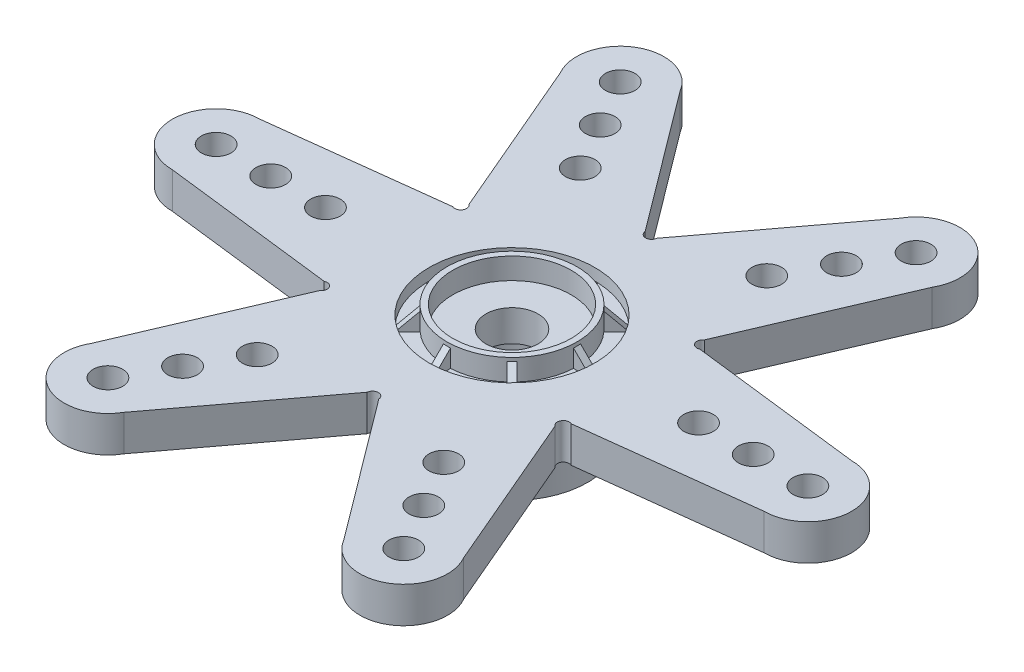
from build123d import *

# Parameters (mm, degrees)
EXTRUDE4_DEPTH          = 1.9304
SKETCH2_R               = 0.6604
CUT_EXTRUDE1_DEPTH      = 19.722050478
CIRPATTERN4_COUNT       = 6
CUT_EXTRUDE2_DEPTH      = 12.7
CUT_EXTRUDE2_DEPTH_BACK = 12.7
SKETCH3_R               = 1.397
SKETCH4_R               = 4.445
CUT_EXTRUDE3_DEPTH      = 0.635
SKETCH5_R               = 3.4925
SKETCH5_R_2             = 3.175
EXTRUDE5_DEPTH          = 1.143
RIB10_REACH             = 26.438
SKETCH8_WALL_W          = 52.220152264
SKETCH8_WALL_H          = 0.381
CIRPATTERN5_COUNT       = 8
SKETCH9_R               = 0.79375
CUT_EXTRUDE4_DEPTH      = 25.392925761
CIRPATTERN6_COUNT       = 6
SKETCH10_R              = 5.08
EXTRUDE6_DEPTH          = 0.762
FILLET2_R               = 0.508
SKETCH11_R              = 4.064
EXTRUDE7_DEPTH          = 3.048
FILLET3_R               = 0.889
SKETCH12_R              = 2.8575
CUT_EXTRUDE5_DEPTH      = 3.429
SKETCH14_R              = 1.397
CUT_EXTRUDE6_DEPTH      = 25.557003564
SKETCH15_R              = 0.3175
CUT_EXTRUDE7_DEPTH      = 25.984806887
CIRPATTERN7_COUNT       = 6


with BuildPart() as part:
    # Sketch1 → Extrude4 (new body)
    with BuildSketch(Plane(origin=(0, 0, 0), x_dir=(1, 0, 0), z_dir=(0, 1, 0))):
        with BuildLine():
            Line((5.775220615, -3.829827046), (0, 0))
            Line((0, 0), (5.775220615, 3.829827046))
            Line((5.775220615, 3.829827046), (6.35029977, 3.829827046))
            Line((6.35029977, 3.829827046), (6.35029977, 3.494998084))
            Line((6.35029977, 3.494998084), (15.87469147, 2.35207108))
            ThreePointArc((15.87469147, 2.35207108), (18.22419147, 0.00257108), (15.87469147, -2.34692892))
            Line((15.87469147, -2.34692892), (6.34969147, -3.48992892))
            Line((6.34969147, -3.48992892), (6.34969147, -3.829827046))
            Line((6.34969147, -3.829827046), (5.775220615, -3.829827046))
        make_face()
    extrude4 = extrude(amount=EXTRUDE4_DEPTH)

    # Sketch2 → Cut-Extrude1 (cut, through all)
    with BuildSketch(Plane(origin=(0, 1.9304, 0), x_dir=(-1, 0, 0), z_dir=(0, 1, 0))):
        with Locations((-6.342552501, -4.149920748)):
            Circle(SKETCH2_R)
        with Locations((-6.342552501, 4.149920748)):
            Circle(SKETCH2_R)
    extrude(amount=-CUT_EXTRUDE1_DEPTH, mode=Mode.SUBTRACT)

    # CirPattern4: Extrude4 ×6 about axis
    cirpattern4_axis = Axis((0, 0, 0), (0, 1, 0))
    for i in range(1, CIRPATTERN4_COUNT):
        add(extrude4.rotate(cirpattern4_axis, i * 360 / CIRPATTERN4_COUNT))

    # Sketch3 → Cut-Extrude2 (cut, two sides: drawn at the far end of the back side and taken through both)
    with BuildSketch(Plane(origin=(0, 1.9304, 0), x_dir=(-1, 0, 0), z_dir=(0, 1, 0)).offset(-CUT_EXTRUDE2_DEPTH_BACK)):
        Circle(SKETCH3_R)
    extrude(amount=CUT_EXTRUDE2_DEPTH + CUT_EXTRUDE2_DEPTH_BACK, mode=Mode.SUBTRACT)

    # Sketch4 → Cut-Extrude3 (cut)
    with BuildSketch(Plane(origin=(0, 1.9304, 0), x_dir=(-1, 0, 0), z_dir=(0, 1, 0))):
        Circle(SKETCH4_R)
    extrude(amount=-CUT_EXTRUDE3_DEPTH, mode=Mode.SUBTRACT)

    # Sketch5 → Extrude5 (add)
    with BuildSketch(Plane(origin=(0, 1.2954, 0), x_dir=(-1, 0, 0), z_dir=(0, 1, 0))):
        Circle(SKETCH5_R)
        Circle(SKETCH5_R_2, mode=Mode.SUBTRACT)
    extrude(amount=EXTRUDE5_DEPTH)

    # Sketch8 wall → Rib10 (add, up to next)
    with BuildSketch(Plane(origin=(-3.967749561, 1.770078976, 0), x_dir=(-0.70753138537, -0.706681921883, 0), z_dir=(0.706681921883, -0.70753138537, 0)), mode=Mode.PRIVATE) as rib10_sk1:
        Rectangle(SKETCH8_WALL_W, SKETCH8_WALL_H)
    rib10_tool1 = extrude(rib10_sk1.sketch, amount=RIB10_REACH, mode=Mode.PRIVATE) - part.part
    rib10 = rib10_tool1.solids().sort_by_distance((-3.967749561, 1.770078976, 0))[0]
    add(rib10)

    # CirPattern5: Rib10 ×8 about axis
    cirpattern5_axis = Axis((0, 0, 0), (0, 1, 0))
    for i in range(1, CIRPATTERN5_COUNT):
        add(rib10.rotate(cirpattern5_axis, i * 360 / CIRPATTERN5_COUNT))

    # Sketch9 → Cut-Extrude4 (cut, through all)
    with BuildSketch(Plane(origin=(0, 1.9304, 0), x_dir=(-1, 0, 0), z_dir=(0, 1, 0))):
        with Locations((7.935119114, 13.749171631)):
            Circle(SKETCH9_R)
        with Locations((6.469197887, 11.209171631)):
            Circle(SKETCH9_R)
        with Locations((5.00327666, 8.669171631)):
            Circle(SKETCH9_R)
    cut_extrude4 = extrude(amount=-CUT_EXTRUDE4_DEPTH, mode=Mode.SUBTRACT)

    # CirPattern6: Cut-Extrude4 ×6 about axis
    cirpattern6_axis = Axis((0, 0, 0), (0, 1, 0))
    for i in range(1, CIRPATTERN6_COUNT):
        add(cut_extrude4.rotate(cirpattern6_axis, i * 360 / CIRPATTERN6_COUNT), mode=Mode.SUBTRACT)

    # Sketch10 → Extrude6 (add)
    with BuildSketch(Plane.XZ):
        Circle(SKETCH10_R)
    extrude(amount=EXTRUDE6_DEPTH)

    # Fillet2
    fillet2_edges = [part.edges().sort_by_distance(p)[0] for p in [
        (-5.08, 0, 0),
    ]]
    fillet(fillet2_edges, radius=FILLET2_R)

    # Sketch11 → Extrude7 (add)
    with BuildSketch(Plane.XZ.offset(0.762)):
        Circle(SKETCH11_R)
    extrude(amount=EXTRUDE7_DEPTH)

    # Fillet3
    fillet3_edges = [part.edges().sort_by_distance(p)[0] for p in [
        (-4.064, -0.762, 0),
    ]]
    fillet(fillet3_edges, radius=FILLET3_R)

    # Sketch12 → Cut-Extrude5 (cut)
    with BuildSketch(Plane.XZ.offset(3.81)):
        Circle(SKETCH12_R)
    extrude(amount=-CUT_EXTRUDE5_DEPTH, mode=Mode.SUBTRACT)

    # Sketch14 → Cut-Extrude6 (cut, through all)
    with BuildSketch(Plane.XZ.offset(0.381)):
        Circle(SKETCH14_R)
    extrude(amount=-CUT_EXTRUDE6_DEPTH, mode=Mode.SUBTRACT)

    # Sketch15 → Cut-Extrude7 (cut, symmetric)
    with BuildSketch(Plane(origin=(0, 1.9304, 0), x_dir=(-1, 0, 0), z_dir=(0, 1, 0))):
        with Locations((-6.48724684, -3.751940905)):
            Circle(SKETCH15_R)
    cut_extrude7 = extrude(amount=CUT_EXTRUDE7_DEPTH, both=True, mode=Mode.SUBTRACT)

    # CirPattern7: Cut-Extrude7 ×6 about axis
    cirpattern7_axis = Axis((0, 0, 0), (0, 1, 0))
    for i in range(1, CIRPATTERN7_COUNT):
        add(cut_extrude7.rotate(cirpattern7_axis, i * 360 / CIRPATTERN7_COUNT), mode=Mode.SUBTRACT)


solid = part.part
